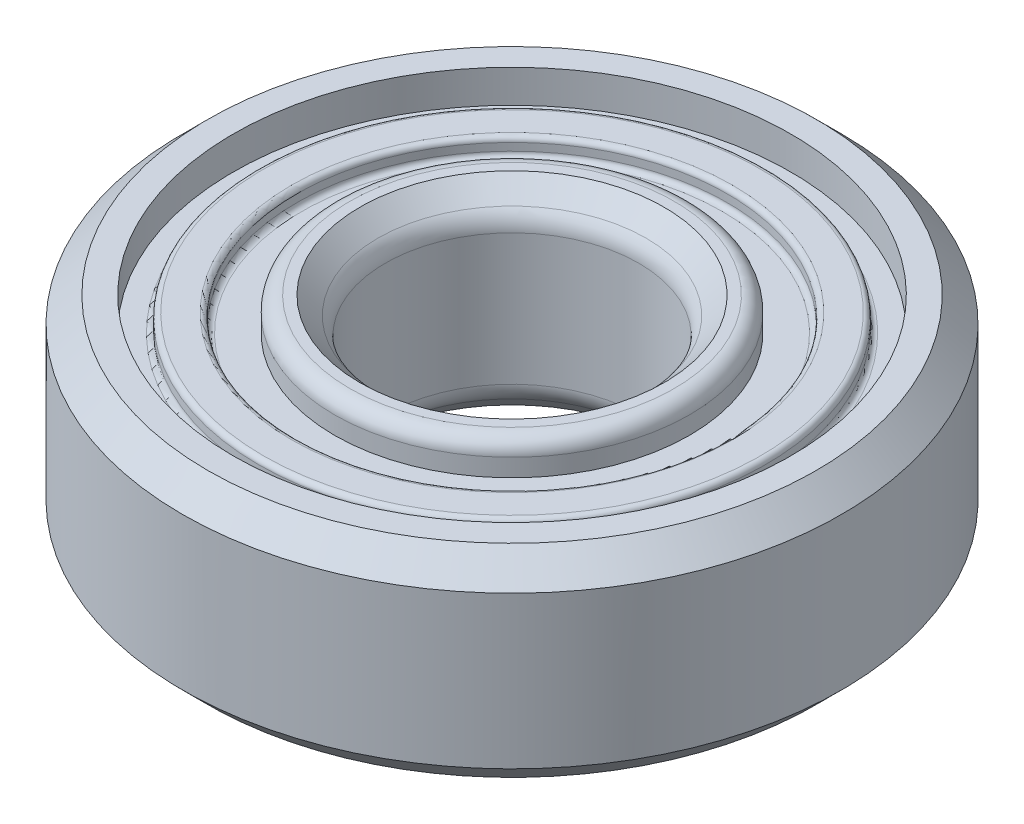
from build123d import *
from build123d.topology import SkipClean

# Parameters (mm, degrees)
SKETCH1_R           = 13
BOSS_EXTRUDE1_DEPTH = 4
SKETCH2_R           = 11
CUT_EXTRUDE1_DEPTH  = 1.3
SKETCH3_R           = 10
SKETCH3_R_2         = 8.5
BOSS_EXTRUDE2_DEPTH = 0.7
SKETCH4_R           = 7
SKETCH4_R_2         = 5
BOSS_EXTRUDE3_DEPTH = 1.3
SKETCH5_R           = 5
CUT_EXTRUDE2_DEPTH  = 19.581980519
CHAMFER1_SIZE       = 1
CHAMFER2_SIZE       = 1
FILLET2_R           = 1
FILLET3_R           = 0.6
FILLET6_R           = 0.2


# Read off the part's stored shape, not the designer's step: Mirror1
with BuildPart() as part:
    # Sketch1 → Boss-Extrude1 (new body)
    with BuildSketch(Plane(origin=(0, 0, 0), x_dir=(1, 0, 0), z_dir=(0, 1, 0))):
        with Locations(Location((0, 0, 0), (0, 0, 270))):
            Circle(SKETCH1_R)
    extrude(amount=BOSS_EXTRUDE1_DEPTH)

    # Sketch2 → Cut-Extrude1 (cut)
    with BuildSketch(Plane(origin=(0, 4, 0), x_dir=(1, 0, 0), z_dir=(0, 1, 0))):
        with Locations(Location((0, 0, 0), (0, 0, 270))):
            Circle(SKETCH2_R)
    extrude(amount=-CUT_EXTRUDE1_DEPTH, mode=Mode.SUBTRACT)

    # Sketch3 → Boss-Extrude2 (add)
    with BuildSketch(Plane(origin=(0, 2.7, 0), x_dir=(1, 0, 0), z_dir=(0, 1, 0))):
        with Locations(Location((0, 0, 0), (0, 0, 270))):
            Circle(SKETCH3_R)
        with Locations(Location((0, 0, 0), (0, 0, 270))):
            Circle(SKETCH3_R_2, mode=Mode.SUBTRACT)
    extrude(amount=BOSS_EXTRUDE2_DEPTH)

    # Sketch4 → Boss-Extrude3 (add)
    with BuildSketch(Plane(origin=(0, 2.7, 0), x_dir=(1, 0, 0), z_dir=(0, 1, 0))):
        with Locations(Location((0, 0, 0), (0, 0, 270))):
            Circle(SKETCH4_R)
        with Locations(Location((0, 0, 0), (0, 0, 270))):
            Circle(SKETCH4_R_2, mode=Mode.SUBTRACT)
    extrude(amount=BOSS_EXTRUDE3_DEPTH)

    # Sketch5 → Cut-Extrude2 (cut, through all)
    with BuildSketch(Plane(origin=(0, 2.7, 0), x_dir=(1, 0, 0), z_dir=(0, 1, 0))):
        with Locations(Location((0, 0, 0), (0, 0, 270))):
            Circle(SKETCH5_R)
    extrude(amount=-CUT_EXTRUDE2_DEPTH, mode=Mode.SUBTRACT)

    # Chamfer1
    chamfer1_edges = [part.edges().sort_by_distance(p)[0] for p in [
        (0, 4, -13),
    ]]
    chamfer(chamfer1_edges, length=CHAMFER1_SIZE)

    # Chamfer2
    chamfer2_edges = [part.edges().sort_by_distance(p)[0] for p in [
        (0, 4, -5),
    ]]
    chamfer(chamfer2_edges, length=CHAMFER2_SIZE)

    # Fillet2
    fillet2_edges = [part.edges().sort_by_distance(p)[0] for p in [
        (0, 3, -5),
    ]]
    fillet(fillet2_edges, radius=FILLET2_R)

    # Fillet3
    fillet3_edges = [part.edges().sort_by_distance(p)[0] for p in [
        (0, 4, -7),
    ]]
    fillet(fillet3_edges, radius=FILLET3_R)

    # Fillet6
    fillet6_edges = [part.edges().sort_by_distance(p)[0] for p in [
        (0, 3.4, -10),
        (0, 2.7, -10),
        (0, 3.4, -8.5),
        (0, 2.7, -8.5),
    ]]
    fillet(fillet6_edges, radius=FILLET6_R)

    # Mirror1 outline → Mirror1 (revolve)
    with SkipClean():  # the faces are left unmerged after this step: merging them gives an invalid solid
        with BuildSketch(Plane.XY):
            with BuildLine():
                Line((13, -3), (13, 0))
                Line((13, 0), (5, 0))
                Line((5, 0), (5, -2.585786438))
                ThreePointArc((5, -2.585786438), (5.076120467, -2.96846987), (5.292893219, -3.292893219))
                Line((5.292893219, -3.292893219), (6, -4))
                Line((6, -4), (6.4, -4))
                ThreePointArc((6.4, -4), (6.824264069, -3.824264069), (7, -3.4))
                Line((7, -3.4), (7, -2.7))
                Line((7, -2.7), (8.3, -2.7))
                ThreePointArc((8.3, -2.7), (8.441421356, -2.758578644), (8.5, -2.9))
                Line((8.5, -2.9), (8.5, -3.2))
                ThreePointArc((8.5, -3.2), (8.558578644, -3.341421356), (8.7, -3.4))
                Line((8.7, -3.4), (9.8, -3.4))
                ThreePointArc((9.8, -3.4), (9.941421356, -3.341421356), (10, -3.2))
                Line((10, -3.2), (10, -2.9))
                ThreePointArc((10, -2.9), (10.058578644, -2.758578644), (10.2, -2.7))
                Line((10.2, -2.7), (11, -2.7))
                Line((11, -2.7), (11, -4))
                Line((11, -4), (12, -4))
                Line((12, -4), (13, -3))
            make_face()
        revolve(axis=Axis((0, 0, 0), (0, 1, 0)))
    add(part.part.scale(1), mode=Mode.REPLACE)  # the faces are merged on a copy


solid = part.part
